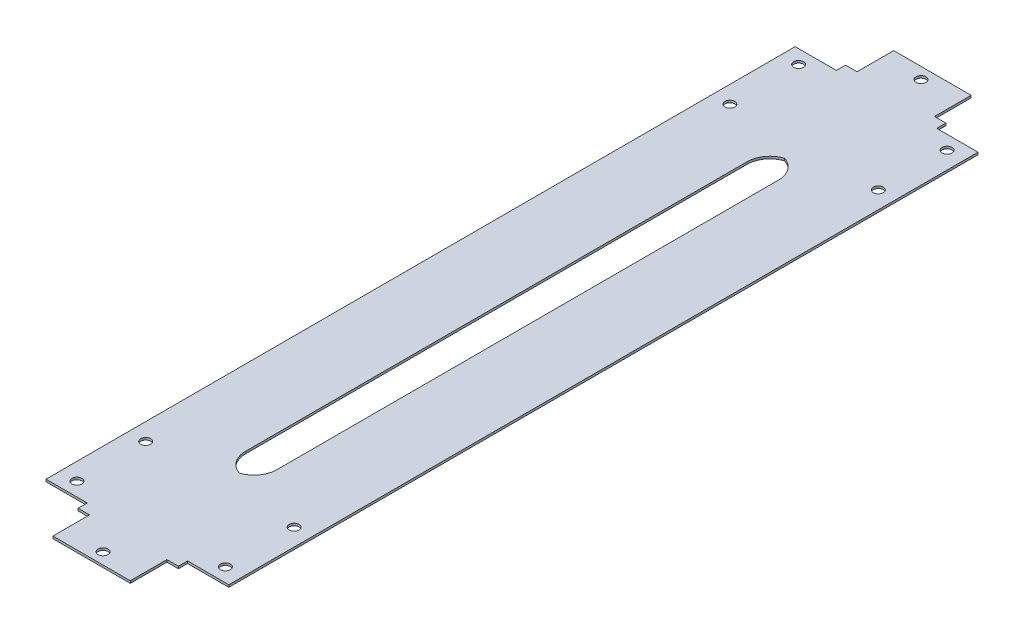
from build123d import *

# Parameters (mm, degrees)
SKETCH1_R           = 2.15
SKETCH1_W           = 13.8
SKETCH1_H           = 239
BOSS_EXTRUDE1_DEPTH = 1
FILLET2_R           = 10


with BuildPart() as part:
    # Sketch1 → Boss-Extrude1 (new body)
    with BuildSketch(Plane(origin=(0, 0, 0), x_dir=(1, 0, 0), z_dir=(0, 1, 0))):
        Polygon((-39.9, -163.5), (-21.9, -163.5), (-21.9, -167.5), (-16.9, -167.5), (-16.9, -183.5), (16.9, -183.5), (16.9, -167.5), (21.9, -167.5), (21.9, -163.5), (39.9, -163.5), (39.9, 163.5), (21.9, 163.5), (21.9, 167.5), (16.9, 167.5), (16.9, 183.5), (-16.9, 183.5), (-16.9, 167.5), (-21.9, 167.5), (-21.9, 163.5), (-39.9, 163.5), align=None)
        with Locations(Location((-32.4, 127.5, 0), (0, 0, 270))):
            Circle(SKETCH1_R, mode=Mode.SUBTRACT)
        with Locations(Location((32.4, 127.5, 0), (0, 0, 270))):
            Circle(SKETCH1_R, mode=Mode.SUBTRACT)
        with Locations(Location((-32.4, -127.5, 0), (0, 0, 270))):
            Circle(SKETCH1_R, mode=Mode.SUBTRACT)
        with Locations(Location((32.4, -127.5, 0), (0, 0, 270))):
            Circle(SKETCH1_R, mode=Mode.SUBTRACT)
        with Locations(Location((-32.4, -157.5, 0), (0, 0, 270))):
            Circle(SKETCH1_R, mode=Mode.SUBTRACT)
        with Locations(Location((32.4, -157.5, 0), (0, 0, 270))):
            Circle(SKETCH1_R, mode=Mode.SUBTRACT)
        with Locations(Location((32.4, 157.5, 0), (0, 0, 270))):
            Circle(SKETCH1_R, mode=Mode.SUBTRACT)
        with Locations(Location((-32.4, 157.5, 0), (0, 0, 270))):
            Circle(SKETCH1_R, mode=Mode.SUBTRACT)
        with Locations(Location((0, 178.5, 0), (0, 0, 270))):
            Circle(SKETCH1_R, mode=Mode.SUBTRACT)
        with Locations(Location((0, -178.5, 0), (0, 0, 270))):
            Circle(SKETCH1_R, mode=Mode.SUBTRACT)
        Rectangle(SKETCH1_W, SKETCH1_H, mode=Mode.SUBTRACT)
    extrude(amount=BOSS_EXTRUDE1_DEPTH)

    # Fillet2
    # the kernel refuses this fillet: 10 mm, written as the material it adds along each edge
    with BuildSketch(Plane(origin=(6.9, 0, -119.5), x_dir=(-1, 0, 0), z_dir=(0, 1, 0)), Plane(origin=(6.9, 0, 119.5), x_dir=(0, 0, -1), z_dir=(0, 1, 0)), Plane(origin=(-6.9, 0, 119.5), x_dir=(1, 0, 0), z_dir=(0, 1, 0))) as fillet2_piece_1:
        with BuildLine():
            CenterArc((FILLET2_R, FILLET2_R), FILLET2_R, 180, 90)
            Line((0, FILLET2_R), (0, 0))
            Line((0, 0), (FILLET2_R, 0))
        make_face()
    extrude(amount=1)
    with BuildSketch(Plane(origin=(-6.9, 0, -119.5), x_dir=(1, 0, 0), z_dir=(0, 1, 0))) as fillet2_piece_2:
        with BuildLine():
            CenterArc((FILLET2_R, -FILLET2_R), FILLET2_R, 90, 90)
            Line((0, -FILLET2_R), (0, 0))
            Line((0, 0), (FILLET2_R, 0))
        make_face()
    extrude(amount=1)


solid = part.part
